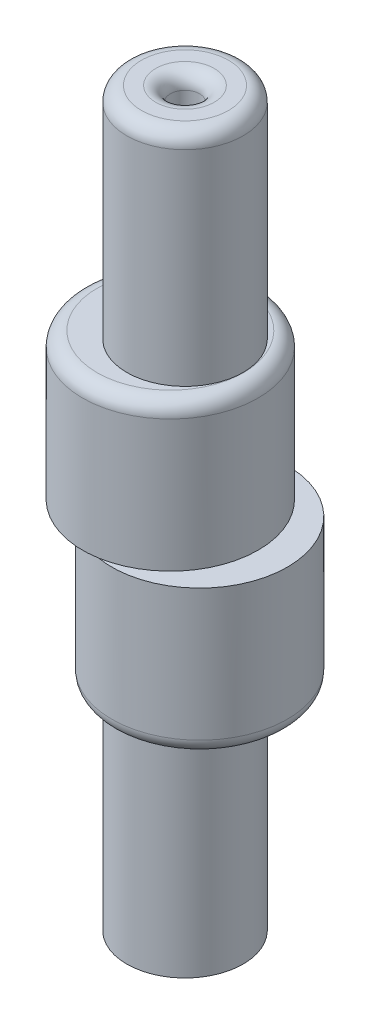
from build123d import *

# Parameters (mm, degrees)
SKETCH1_R           = 3.975
BOSS_EXTRUDE1_DEPTH = 15
SKETCH2_R           = 6
BOSS_EXTRUDE2_DEPTH = 10
SKETCH3_R           = 6
BOSS_EXTRUDE3_DEPTH = 10
SKETCH4_R           = 3.975
BOSS_EXTRUDE4_DEPTH = 15
CUT_EXTRUDE1_DEPTH  = 35.1
SKETCH6_R           = 1
CUT_EXTRUDE2_DEPTH  = 45
FILLET1_R           = 1
FILLET2_R           = 1


with BuildPart() as part:
    # Sketch1 → Boss-Extrude1 (new body)
    with BuildSketch(Plane(origin=(0, 0, 0), x_dir=(1, 0, 0), z_dir=(0, 1, 0))):
        with Locations(Location((0, 0, 0), (0, 0, 270))):
            Circle(SKETCH1_R)
    extrude(amount=BOSS_EXTRUDE1_DEPTH)

    # Sketch2 → Boss-Extrude2 (add)
    with BuildSketch(Plane(origin=(0, 15, 0), x_dir=(1, 0, 0), z_dir=(0, 1, 0))):
        with Locations(Location((1, 0, 0), (0, 0, 270))):
            Circle(SKETCH2_R)
    extrude(amount=BOSS_EXTRUDE2_DEPTH)

    # Sketch3 → Boss-Extrude3 (add)
    with BuildSketch(Plane(origin=(0, 25, 0), x_dir=(1, 0, 0), z_dir=(0, 1, 0))):
        with Locations(Location((-1, 0, 0), (0, 0, 80.405931773))):
            Circle(SKETCH3_R)
    extrude(amount=BOSS_EXTRUDE3_DEPTH)

    # Sketch4 → Boss-Extrude4 (add)
    with BuildSketch(Plane(origin=(0, 35, 0), x_dir=(1, 0, 0), z_dir=(0, 1, 0))):
        with Locations(Location((0, 0, 0), (0, 0, 270))):
            Circle(SKETCH4_R)
    extrude(amount=BOSS_EXTRUDE4_DEPTH)

    # Sketch5 → Cut-Extrude1 (cut)
    with BuildSketch(Plane.XZ):
        with BuildLine():
            Line((-1.549193338, 2.15), (1.549193338, 2.15))
            ThreePointArc((1.549193338, 2.15), (0, -2.65), (-1.549193338, 2.15))
        make_face()
    extrude(amount=-CUT_EXTRUDE1_DEPTH, mode=Mode.SUBTRACT)

    # Sketch6 → Cut-Extrude2 (cut)
    with BuildSketch(Plane(origin=(0, 50, 0), x_dir=(1, 0, 0), z_dir=(0, 1, 0))):
        with Locations(Location((0, 0, 0), (0, 0, 270))):
            Circle(SKETCH6_R)
    extrude(amount=-CUT_EXTRUDE2_DEPTH, mode=Mode.SUBTRACT)

    # Fillet1
    fillet1_edges = [part.edges().sort_by_distance(p)[0] for p in [
        (-2, 35, 5.916079783),
        (0, 50, -3.975),
        (0, 50, -1),
        (1, 15, -6),
    ]]
    fillet(fillet1_edges, radius=FILLET1_R)

    # Fillet2
    fillet2_edges = [part.edges().sort_by_distance(p)[0] for p in [
        (0, 0, -2.65),
        (0, 0, 2.15),
    ]]
    fillet(fillet2_edges, radius=FILLET2_R)

    # Chamfer1: read off the stored shape, not the designer's step
    # Chamfer1 outline → Chamfer1 (revolve)
    with BuildSketch(Plane.XY):
        Polygon((2.65, 35.1), (1.65, 35.1), (2.65, 34.1), align=None)
    revolve(axis=Axis((0, 0, 0), (0, 1, 0)))


solid = part.part
